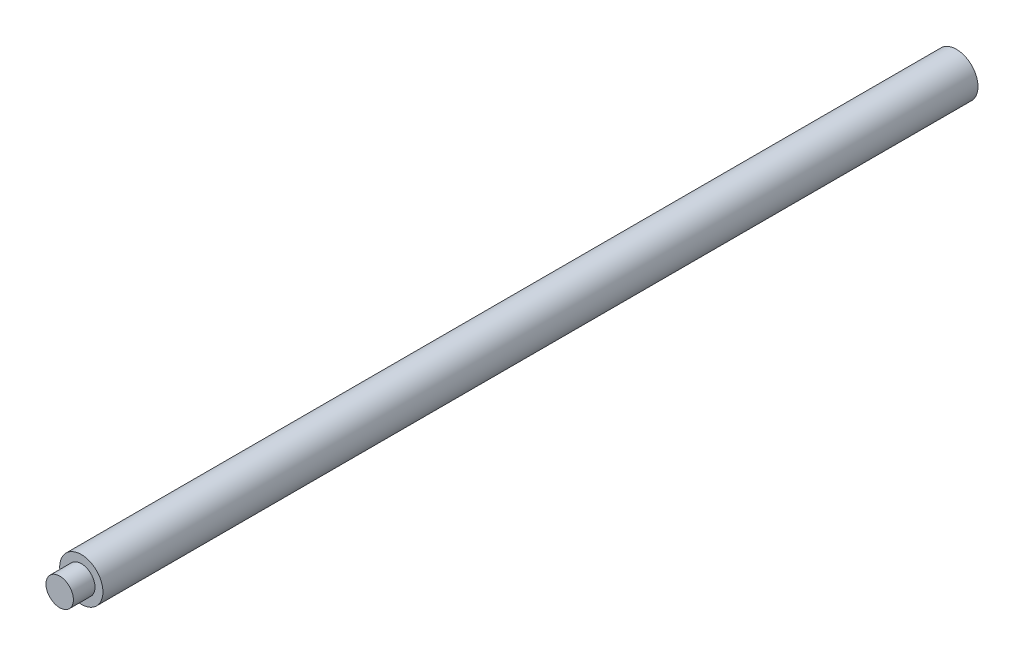
from build123d import *

# Parameters (mm, degrees)
SKETCH1_R           = 10
SKETCH1_R_2         = 8
BOSS_EXTRUDE1_DEPTH = 395
SKETCH2_R           = 10
BOSS_EXTRUDE2_DEPTH = 10
SKETCH3_R           = 6.35
BOSS_EXTRUDE3_DEPTH = 10


with BuildPart() as part:
    # Sketch1 → Boss-Extrude1 (new body)
    with BuildSketch(Plane.XY):
        Circle(SKETCH1_R)
        Circle(SKETCH1_R_2, mode=Mode.SUBTRACT)
    extrude(amount=BOSS_EXTRUDE1_DEPTH)

    # Sketch2 → Boss-Extrude2 (add)
    with BuildSketch(Plane.XY.offset(395)):
        Circle(SKETCH2_R)
    extrude(amount=BOSS_EXTRUDE2_DEPTH)

    # Sketch3 → Boss-Extrude3 (add)
    with BuildSketch(Plane.XY.offset(405)):
        Circle(SKETCH3_R)
    extrude(amount=BOSS_EXTRUDE3_DEPTH)


solid = part.part
